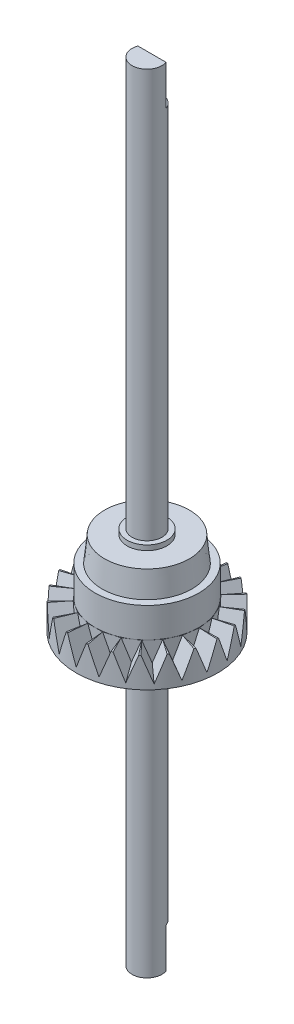
from build123d import *

# Parameters (mm, degrees)
SKETCH2_R           = 1.5
BOSS_EXTRUDE1_DEPTH = 27
SKETCH3_R           = 2.5
BOSS_EXTRUDE2_DEPTH = 2
SKETCH4_R           = 7.1
BOSS_EXTRUDE3_DEPTH = 3
SKETCH5_R           = 5.2
BOSS_EXTRUDE4_DEPTH = 3
SKETCH6_R           = 4.5
SKETCH7_R           = 4.25
SKETCH8_R           = 2
BOSS_EXTRUDE5_DEPTH = 0.5
SKETCH9_R           = 1.5
BOSS_EXTRUDE6_DEPTH = 41
CUT_EXTRUDE1_DEPTH  = 4
CUT_EXTRUDE2_START  = -4
CUT_EXTRUDE2_DEPTH  = 4
CIRPATTERN2_COUNT   = 22


with BuildPart() as part:
    # Sketch2 → Boss-Extrude1 (new body)
    with BuildSketch(Plane(origin=(0, 0, 0), x_dir=(1, 0, 0), z_dir=(0, 1, 0))):
        Circle(SKETCH2_R)
    extrude(amount=BOSS_EXTRUDE1_DEPTH)

    # Sketch10 → Cut-Extrude1 (cut)
    with BuildSketch(Plane(origin=(0, 0, 0), x_dir=(1, 0, 0), z_dir=(0, 1, 0))):
        with BuildLine():
            Line((-1.414213562, 0.5), (1.414213562, 0.5))
            ThreePointArc((1.414213562, 0.5), (0, 1.5), (-1.414213562, 0.5))
        make_face()
    extrude(amount=CUT_EXTRUDE1_DEPTH, mode=Mode.SUBTRACT)


with BuildPart() as body_2:
    # Sketch3 → Boss-Extrude2 (new body)
    with BuildSketch(Plane(origin=(0, 27, 0), x_dir=(1, 0, 0), z_dir=(0, 1, 0))):
        Circle(SKETCH3_R)
    extrude(amount=BOSS_EXTRUDE2_DEPTH)

    # Sketch4 → Boss-Extrude3 (add)
    with BuildSketch(Plane(origin=(0, 29, 0), x_dir=(1, 0, 0), z_dir=(0, 1, 0))):
        Circle(SKETCH4_R)
    extrude(amount=BOSS_EXTRUDE3_DEPTH)

    # Sketch12 → Cut-Loft8 section 0
    with BuildSketch(Plane.XY.offset(7.1)):
        with BuildLine():
            Line((0, 29.5), (-0.75, 31.5))
            Line((-0.75, 31.5), (-0.9375, 32))
            Line((-0.9375, 32), (0.9375, 32))
            Line((0.9375, 32), (0.75, 31.5))
            Line((0.75, 31.5), (0, 29.5))
        make_face()
    # Sketch13 → Cut-Loft8 section 1
    with BuildSketch(Plane.XY.offset(5.2)):
        with BuildLine():
            Line((0, 30), (-0.75, 32))
            Line((-0.75, 32), (0.75, 32))
            Line((0.75, 32), (0, 30))
        make_face()
    cut_loft8 = loft(mode=Mode.SUBTRACT)

    # CirPattern2: Cut-Loft8 ×22 about axis
    cirpattern2_axis = Axis((0, 32, 0), (0, -1, 0))
    for i in range(1, CIRPATTERN2_COUNT):
        add(cut_loft8.rotate(cirpattern2_axis, i * 360 / CIRPATTERN2_COUNT), mode=Mode.SUBTRACT)


with BuildPart() as body_3:
    # Sketch5 → Boss-Extrude4 (new body)
    with BuildSketch(Plane(origin=(0, 32, 0), x_dir=(1, 0, 0), z_dir=(0, 1, 0))):
        Circle(SKETCH5_R)
    extrude(amount=BOSS_EXTRUDE4_DEPTH)

    # Sketch6 → Loft1 section 0
    with BuildSketch(Plane(origin=(0, 35, 0), x_dir=(1, 0, 0), z_dir=(0, 1, 0))):
        Circle(SKETCH6_R)
    # Sketch7 → Loft1 section 1
    with BuildSketch(Plane(origin=(0, 37.5, 0), x_dir=(1, 0, 0), z_dir=(0, 1, 0))):
        Circle(SKETCH7_R)
    loft()

    # Sketch8 → Boss-Extrude5 (add)
    with BuildSketch(Plane(origin=(0, 37.5, 0), x_dir=(1, 0, 0), z_dir=(0, 1, 0))):
        Circle(SKETCH8_R)
    extrude(amount=BOSS_EXTRUDE5_DEPTH)


with BuildPart() as body_4:
    # Sketch9 → Boss-Extrude6 (new body)
    with BuildSketch(Plane(origin=(0, 38, 0), x_dir=(1, 0, 0), z_dir=(0, 1, 0))):
        Circle(SKETCH9_R)
    extrude(amount=BOSS_EXTRUDE6_DEPTH)

    # Sketch11 → Cut-Extrude2 (cut)
    with BuildSketch(Plane(origin=(0, 79, 0), x_dir=(1, 0, 0), z_dir=(0, 1, 0)).offset(CUT_EXTRUDE2_START)):
        with BuildLine():
            Line((-1.414213562, 0.5), (1.414213562, 0.5))
            ThreePointArc((1.414213562, 0.5), (0, 1.5), (-1.414213562, 0.5))
        make_face()
    extrude(amount=CUT_EXTRUDE2_DEPTH, mode=Mode.SUBTRACT)


solid = Compound([part.part, body_2.part, body_3.part, body_4.part])
